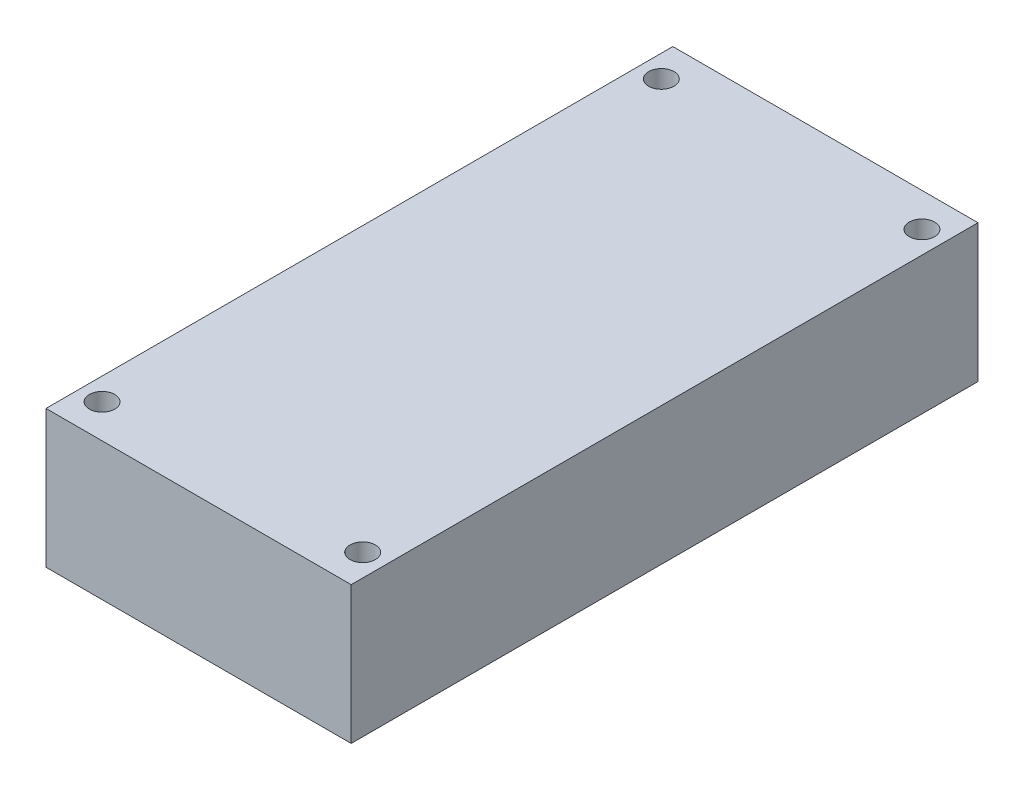
from build123d import *

# Parameters (mm, degrees)
SKETCH1_W           = 42.51
SKETCH1_H           = 87.31
SKETCH1_R           = 1.77
BOSS_EXTRUDE1_DEPTH = 19.16


with BuildPart() as part:
    # Sketch1 → Boss-Extrude1 (new body)
    with BuildSketch(Plane(origin=(0, 0, 0), x_dir=(1, 0, 0), z_dir=(0, 1, 0))):
        with Locations((21.255, 43.655)):
            Rectangle(SKETCH1_W, SKETCH1_H)
        with Locations((3.105, 82.605)):
            Circle(SKETCH1_R, mode=Mode.SUBTRACT)
        with Locations((39.405, 82.605)):
            Circle(SKETCH1_R, mode=Mode.SUBTRACT)
        with Locations((3.105, 4.705)):
            Circle(SKETCH1_R, mode=Mode.SUBTRACT)
        with Locations((39.405, 4.705)):
            Circle(SKETCH1_R, mode=Mode.SUBTRACT)
    extrude(amount=BOSS_EXTRUDE1_DEPTH)


solid = part.part
